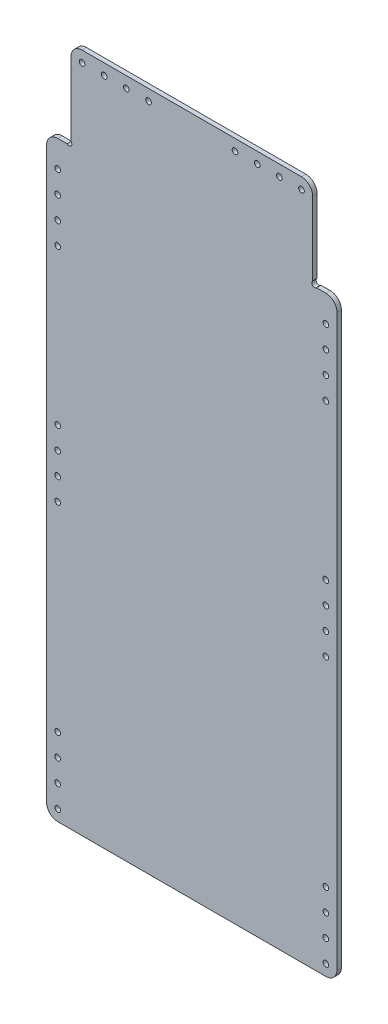
from build123d import *

# Parameters (mm, degrees)
SKETCH1_R           = 2.55
BOSS_EXTRUDE1_DEPTH = 4
FILLET1_R           = 10


with BuildPart() as part:
    # Sketch1 → Boss-Extrude1 (new body)
    with BuildSketch(Plane.XY):
        with BuildLine():
            Line((112.535533906, 534), (131, 534))
            Line((131, 534), (131, 0))
            Line((131, 0), (-131, 0))
            Line((-131, 0), (-131, 534))
            Line((-131, 534), (-112.535533906, 534))
            ThreePointArc((-112.535533906, 534), (-109, 534), (-109, 537.535533906))
            Line((-109, 537.535533906), (-109, 614))
            Line((-109, 614), (109, 614))
            Line((109, 614), (109, 537.535533906))
            ThreePointArc((109, 537.535533906), (109, 534), (112.535533906, 534))
        make_face()
        with Locations((-121, 10)):
            Circle(SKETCH1_R, mode=Mode.SUBTRACT)
        with Locations((-121, 30)):
            Circle(SKETCH1_R, mode=Mode.SUBTRACT)
        with Locations((-121, 50)):
            Circle(SKETCH1_R, mode=Mode.SUBTRACT)
        with Locations((-121, 70)):
            Circle(SKETCH1_R, mode=Mode.SUBTRACT)
        with Locations((-121, 250)):
            Circle(SKETCH1_R, mode=Mode.SUBTRACT)
        with Locations((-121, 270)):
            Circle(SKETCH1_R, mode=Mode.SUBTRACT)
        with Locations((-121, 290)):
            Circle(SKETCH1_R, mode=Mode.SUBTRACT)
        with Locations((-121, 310)):
            Circle(SKETCH1_R, mode=Mode.SUBTRACT)
        with Locations((-121, 450)):
            Circle(SKETCH1_R, mode=Mode.SUBTRACT)
        with Locations((-121, 470)):
            Circle(SKETCH1_R, mode=Mode.SUBTRACT)
        with Locations((-121, 490)):
            Circle(SKETCH1_R, mode=Mode.SUBTRACT)
        with Locations((-121, 510)):
            Circle(SKETCH1_R, mode=Mode.SUBTRACT)
        with Locations((-99, 604)):
            Circle(SKETCH1_R, mode=Mode.SUBTRACT)
        with Locations((-79, 604)):
            Circle(SKETCH1_R, mode=Mode.SUBTRACT)
        with Locations((-59, 604)):
            Circle(SKETCH1_R, mode=Mode.SUBTRACT)
        with Locations((-39, 604)):
            Circle(SKETCH1_R, mode=Mode.SUBTRACT)
        with Locations((121, 10)):
            Circle(SKETCH1_R, mode=Mode.SUBTRACT)
        with Locations((121, 510)):
            Circle(SKETCH1_R, mode=Mode.SUBTRACT)
        with Locations((121, 490)):
            Circle(SKETCH1_R, mode=Mode.SUBTRACT)
        with Locations((121, 470)):
            Circle(SKETCH1_R, mode=Mode.SUBTRACT)
        with Locations((121, 450)):
            Circle(SKETCH1_R, mode=Mode.SUBTRACT)
        with Locations((121, 310)):
            Circle(SKETCH1_R, mode=Mode.SUBTRACT)
        with Locations((121, 290)):
            Circle(SKETCH1_R, mode=Mode.SUBTRACT)
        with Locations((121, 270)):
            Circle(SKETCH1_R, mode=Mode.SUBTRACT)
        with Locations((121, 250)):
            Circle(SKETCH1_R, mode=Mode.SUBTRACT)
        with Locations((121, 70)):
            Circle(SKETCH1_R, mode=Mode.SUBTRACT)
        with Locations((121, 50)):
            Circle(SKETCH1_R, mode=Mode.SUBTRACT)
        with Locations((121, 30)):
            Circle(SKETCH1_R, mode=Mode.SUBTRACT)
        with Locations((39, 604)):
            Circle(SKETCH1_R, mode=Mode.SUBTRACT)
        with Locations((59, 604)):
            Circle(SKETCH1_R, mode=Mode.SUBTRACT)
        with Locations((79, 604)):
            Circle(SKETCH1_R, mode=Mode.SUBTRACT)
        with Locations((99, 604)):
            Circle(SKETCH1_R, mode=Mode.SUBTRACT)
    extrude(amount=BOSS_EXTRUDE1_DEPTH)

    # Fillet1
    fillet1_edges = [part.edges().sort_by_distance(p)[0] for p in [
        (-131, 0, 2),
        (131, 0, 2),
        (131, 534, 2),
        (109, 614, 2),
        (-109, 614, 2),
        (-131, 534, 2),
    ]]
    fillet(fillet1_edges, radius=FILLET1_R)


solid = part.part
